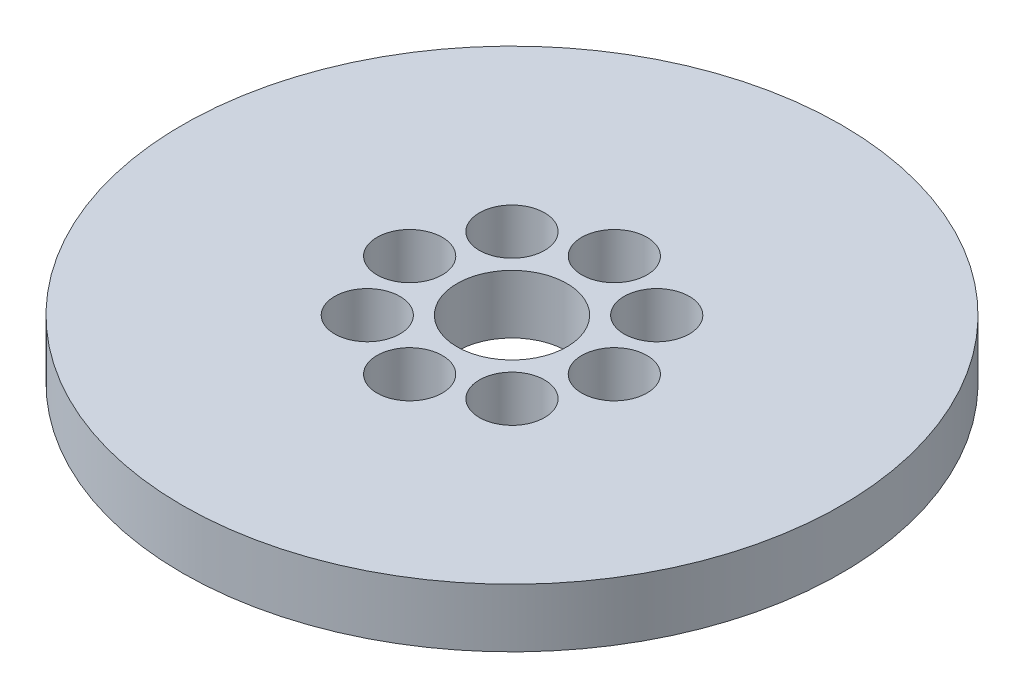
from build123d import *

# Parameters (mm, degrees)
SKETCH1_R           = 45
BOSS_EXTRUDE1_DEPTH = 8
SKETCH2_R           = 7.5
CUT_EXTRUDE1_DEPTH  = 65.140470843
SKETCH3_R           = 4.454529992
CUT_EXTRUDE2_DEPTH  = 7.050147223
CIRPATTERN1_COUNT   = 8


with BuildPart() as part:
    # Sketch1 → Boss-Extrude1 (new body)
    with BuildSketch(Plane(origin=(0, 0, 0), x_dir=(1, 0, 0), z_dir=(0, 1, 0))):
        Circle(SKETCH1_R)
    extrude(amount=BOSS_EXTRUDE1_DEPTH)

    # Sketch2 → Cut-Extrude1 (cut, through all)
    with BuildSketch(Plane(origin=(0, 0, 0), x_dir=(1, 0, 0), z_dir=(0, 1, 0))):
        Circle(SKETCH2_R)
    extrude(amount=CUT_EXTRUDE1_DEPTH, mode=Mode.SUBTRACT)

    # Sketch3 → Cut-Extrude2 (cut)
    with BuildSketch(Plane(origin=(0, 8, 0), x_dir=(1, 0, 0), z_dir=(0, 1, 0))):
        with Locations((-13.973835942, 0)):
            Circle(SKETCH3_R)
    cut_extrude2 = extrude(amount=-CUT_EXTRUDE2_DEPTH, mode=Mode.SUBTRACT)

    # CirPattern1: Cut-Extrude2 ×8 about axis
    cirpattern1_axis = Axis((0, 0, 0), (0, 1, 0))
    for i in range(1, CIRPATTERN1_COUNT):
        add(cut_extrude2.rotate(cirpattern1_axis, i * 360 / CIRPATTERN1_COUNT), mode=Mode.SUBTRACT)


solid = part.part
